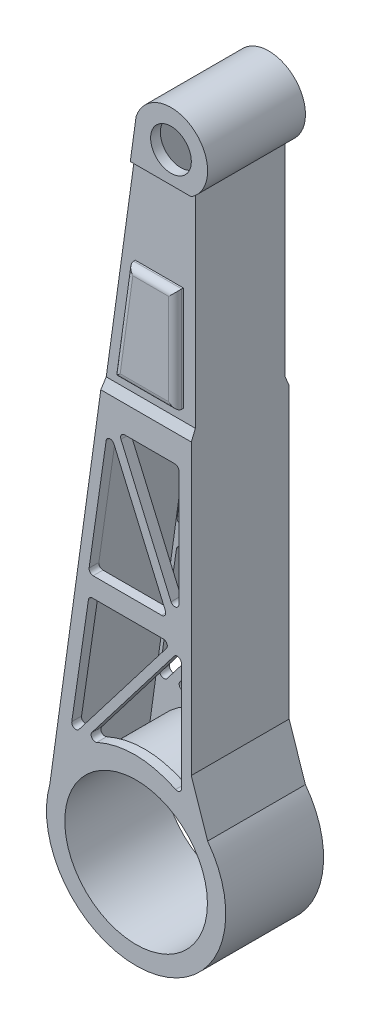
from build123d import *

# Parameters (mm, degrees)
BOSS_EXTRUDE1_DEPTH = 120
SKETCH2_R           = 87.5
CUT_EXTRUDE1_DEPTH  = 120
SKETCH3_R           = 25
CUT_EXTRUDE2_DEPTH  = 120
SHELL2_START        = 12
SHELL2_OUTLINE_R    = 25
SHELL2_DEPTH        = 96
CUT_EXTRUDE4_DEPTH  = 120
CUT_EXTRUDE5_DEPTH  = 120
BOSS_EXTRUDE2_DEPTH = 10
BOSS_EXTRUDE3_DEPTH = 10
FILLET1_R           = 8


# Read off the part's stored shape, not the designer's step: Shell2
with BuildPart() as part:
    # Sketch1 → Boss-Extrude1 (new body)
    with BuildSketch(Plane.XY):
        with BuildLine():
            Line((-105.840625, 29.962678445), (0, 792.401413426))
            ThreePointArc((0, 792.401413426), (69.989991069, 814.210311801), (67.715560492, 740.936483843))
            Line((67.715560492, 740.936483843), (67.715560492, 126.004465834))
            Line((67.715560492, 126.004465834), (87.732689968, 66.35491776))
            ThreePointArc((87.732689968, 66.35491776), (20.324199821, -108.106090955), (-105.840625, 29.962678445))
        make_face()
    extrude(amount=BOSS_EXTRUDE1_DEPTH)

    # Sketch2 → Cut-Extrude1 (cut)
    with BuildSketch(Plane.XY.offset(120)):
        Circle(SKETCH2_R)
    extrude(amount=-CUT_EXTRUDE1_DEPTH, mode=Mode.SUBTRACT)

    # Sketch3 → Cut-Extrude2 (cut)
    with BuildSketch(Plane.XY.offset(120)):
        with Locations((42.760873913, 778.383294358)):
            Circle(SKETCH3_R)
    extrude(amount=-CUT_EXTRUDE2_DEPTH, mode=Mode.SUBTRACT)

    # Shell2 outline → Shell2 (cut)
    with BuildSketch(Plane.XY.offset(SHELL2_START)):
        with BuildLine():
            Line((75.655144686, 64.626225966), (55.715560492, 124.0446949))
            Line((55.715560492, 124.0446949), (55.715560492, 748.032411411))
            ThreePointArc((55.715560492, 748.032411411), (65.426599219, 802.367974809), (11.726520361, 789.602425324))
            Line((11.726520361, 789.602425324), (-92.959881421, 35.478309517))
            ThreePointArc((-92.959881421, 35.478309517), (-16.948856501, 98.045837562), (75.655144686, 64.626225966))
        make_face()
        with Locations((42.760873913, 778.383294358)):
            Circle(SHELL2_OUTLINE_R, mode=Mode.SUBTRACT)
    extrude(amount=SHELL2_DEPTH, mode=Mode.SUBTRACT)

    # Sketch4 → Cut-Extrude4 (cut)
    with BuildSketch(Plane.XY.offset(120)):
        with BuildLine():
            Line((-54.201038132, 110.893822017), (46.63374807, 242.267143469))
            ThreePointArc((46.63374807, 242.267143469), (52.207619727, 243.957335897), (55.600099295, 239.222794941))
            Line((55.600099295, 239.222794941), (55.600099295, 106.065561115))
            ThreePointArc((55.600099295, 106.065561115), (53.272224451, 101.839481708), (48.456200434, 101.548515878))
            add(Edge.make_bspline(
                [(-48.203411652, 103.280674868), (-32.29772345, 110.352299936), (0.49057596, 117.216976021), (32.14071495, 109.29223969), (48.456200434, 101.548515878)],
                knots=[0.164763499, 0.164763499, 0.164763499, 0.164763499, 0.551333425, 0.942878972, 0.942878972, 0.942878972, 0.942878972], degree=3))
            ThreePointArc((-48.203411652, 103.280674868), (-54.162298411, 104.755306741), (-54.201038132, 110.893822017))
        make_face()
        with BuildLine():
            Line((-53.553065242, 253.949018208), (33.287473267, 253.949018208))
            ThreePointArc((33.287473267, 253.949018208), (37.771987881, 251.160155626), (37.253824493, 245.90466968))
            Line((37.253824493, 245.90466968), (-70.005272034, 106.161389635))
            ThreePointArc((-70.005272034, 106.161389635), (-75.918077174, 104.600163589), (-78.919089143, 109.928636031))
            Line((-78.919089143, 109.928636031), (-58.500531126, 249.671916076))
            ThreePointArc((-58.500531126, 249.671916076), (-56.823043121, 252.731510068), (-53.553065242, 253.949018208))
        make_face()
        with BuildLine():
            Line((-52.732234928, 278.037445865), (31.376208078, 278.037445865))
            ThreePointArc((31.376208078, 278.037445865), (35.555871549, 280.293286019), (35.964073946, 285.02528056))
            Line((35.964073946, 285.02528056), (-27.226737743, 430.86787452))
            ThreePointArc((-27.226737743, 430.86787452), (-32.478658579, 433.835746738), (-36.76395609, 429.589906043))
            Line((-36.76395609, 429.589906043), (-57.681587406, 283.747312082))
            ThreePointArc((-57.681587406, 283.747312082), (-56.510417764, 279.762490223), (-52.732234928, 278.037445865))
        make_face()
        with BuildLine():
            Line((-14.009585394, 447.087418489), (47.46310653, 447.087418489))
            ThreePointArc((47.46310653, 447.087418489), (50.998640436, 445.622952394), (52.46310653, 442.087418489))
            Line((52.46310653, 442.087418489), (52.46310653, 300.210196021))
            ThreePointArc((52.46310653, 300.210196021), (48.478160878, 295.314313601), (42.875240662, 298.222361327))
            Line((42.875240662, 298.222361327), (-18.597451263, 440.099583794))
            ThreePointArc((-18.597451263, 440.099583794), (-18.189248866, 444.831578335), (-14.009585394, 447.087418489))
        make_face()
    extrude(amount=-CUT_EXTRUDE4_DEPTH, mode=Mode.SUBTRACT)

    # Sketch6 → Cut-Extrude5 (cut)
    with BuildSketch(Plane(origin=(67.715560492, 0, 0), x_dir=(0, 0, -1), z_dir=(1, 0, 0))):
        Polygon((-120, 480.355293397), (-115, 492.394948365), (-115, 740.936483843), (-120, 740.936483843), align=None)
        Polygon((0, 740.936483843), (-5, 740.936483843), (-5, 492.394948365), (0, 480.355293397), align=None)
    extrude(amount=-CUT_EXTRUDE5_DEPTH, mode=Mode.SUBTRACT)

    # Sketch9 → Boss-Extrude2 (add)
    with BuildSketch(Plane(origin=(0, 0, 5), x_dir=(-1, 0, 0), z_dir=(0, 0, -1))):
        Polygon((-52.957009084, 634.164562087), (5.972067956, 634.164562087), (23.731094104, 506.234767355), (-52.957009084, 506.234767355), align=None)
    extrude(amount=BOSS_EXTRUDE2_DEPTH)

    # Sketch7 → Boss-Extrude3 (add)
    with BuildSketch(Plane.XY.offset(115)):
        Polygon((-5.972067956, 634.164562087), (52.957009084, 634.164562087), (52.957009084, 506.234767355), (-23.731094104, 506.234767355), align=None)
    extrude(amount=BOSS_EXTRUDE3_DEPTH)

    # Fillet1
    fillet1_edges = [part.edges().sort_by_distance(p)[0] for p in [
        (52.957009084, 570.199664721, -5),
        (14.61295749, 506.234767355, -5),
        (-14.85158103, 570.199664721, -5),
        (23.492470564, 634.164562087, -5),
        (-14.85158103, 570.199664721, 125),
        (14.61295749, 506.234767355, 125),
        (52.957009084, 570.199664721, 125),
        (23.492470564, 634.164562087, 125),
    ]]
    fillet(fillet1_edges, radius=FILLET1_R)


solid = part.part
